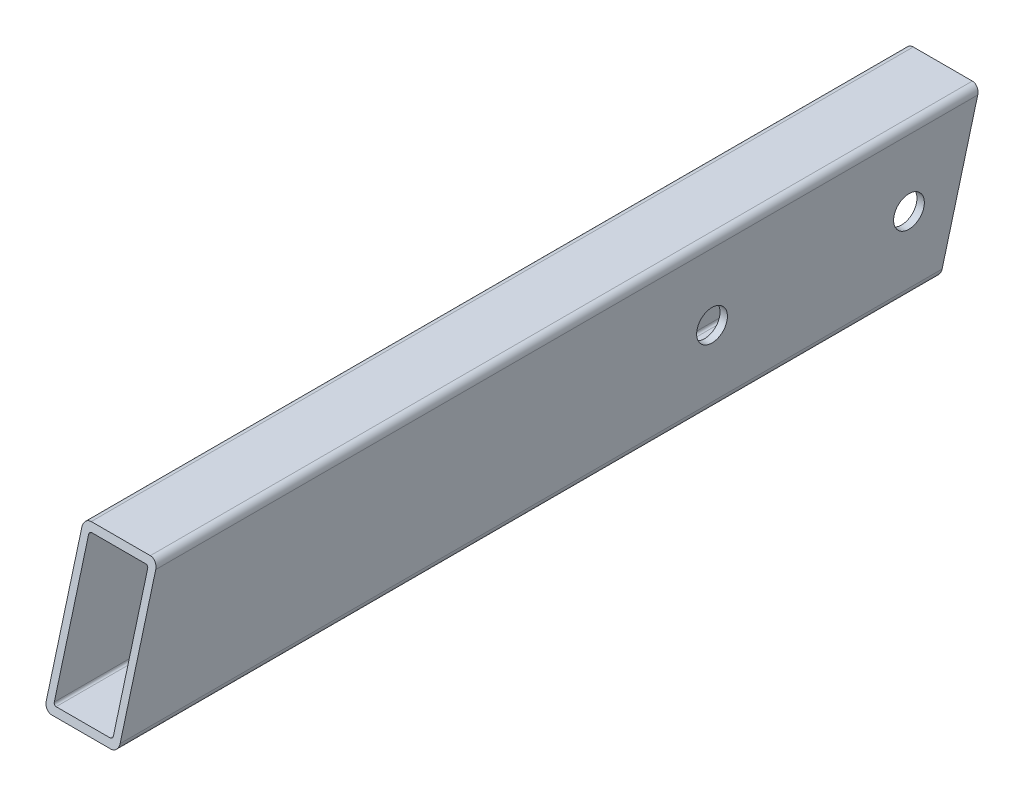
from build123d import *

# Parameters (mm, degrees)
DODANIE_WYCI_GNI_CIE1_DEPTH     = 350
WYTNIJ_WYCI_GNI_CIE1_DEPTH      = 52
WYTNIJ_WYCI_GNI_CIE1_DEPTH_BACK = 50
WYTNIJ_WYCI_GNI_CIE2_DEPTH      = 31
WYTNIJ_WYCI_GNI_CIE2_DEPTH_BACK = 26
SZKIC3_R                        = 6.25


with BuildPart() as part:
    # Szkic1 → Dodanie-wyciągnięcie1 (new body)
    with BuildSketch(Plane.XY):
        with BuildLine():
            Line((-8.196850851, -30), (15.803149149, -30))
            ThreePointArc((15.803149149, -30), (17.924469493, -29.121320344), (18.803149149, -27))
            Line((18.803149149, -27), (18.803149149, 27))
            ThreePointArc((18.803149149, 27), (17.924469493, 29.121320344), (15.803149149, 30))
            Line((15.803149149, 30), (-8.196850851, 30))
            ThreePointArc((-8.196850851, 30), (-10.318171195, 29.121320344), (-11.196850851, 27))
            Line((-11.196850851, 27), (-11.196850851, -27))
            ThreePointArc((-11.196850851, -27), (-10.318171195, -29.121320344), (-8.196850851, -30))
        make_face()
        with BuildLine():
            Line((-7.196850851, 27), (14.803149149, 27))
            ThreePointArc((14.803149149, 27), (15.51025593, 26.707106781), (15.803149149, 26))
            Line((15.803149149, 26), (15.803149149, -26))
            ThreePointArc((15.803149149, -26), (15.51025593, -26.707106781), (14.803149149, -27))
            Line((14.803149149, -27), (-7.196850851, -27))
            ThreePointArc((-7.196850851, -27), (-7.903957632, -26.707106781), (-8.196850851, -26))
            Line((-8.196850851, -26), (-8.196850851, 26))
            ThreePointArc((-8.196850851, 26), (-7.903957632, 26.707106781), (-7.196850851, 27))
        make_face(mode=Mode.SUBTRACT)
    extrude(amount=-DODANIE_WYCI_GNI_CIE1_DEPTH)

    # Szkic2 → Wytnij-wyciągnięcie1 (cut, two sides: drawn at the far end of the back side and taken through both)
    with BuildSketch(Plane(origin=(0, 0, 0), x_dir=(0, 0, -1), z_dir=(1, 0, 0)).offset(-WYTNIJ_WYCI_GNI_CIE1_DEPTH_BACK)):
        Polygon((0, -30), (16.076951546, 30), (0, 30), align=None)
        Polygon((350, 30), (333.923048454, -30), (350, -30), align=None)
    extrude(amount=WYTNIJ_WYCI_GNI_CIE1_DEPTH + WYTNIJ_WYCI_GNI_CIE1_DEPTH_BACK, mode=Mode.SUBTRACT)

    # Szkic3 → Wytnij-wyciągnięcie2 (cut, two sides: drawn at the far end of the back side and taken through both)
    with BuildSketch(Plane(origin=(0, 0, 0), x_dir=(0, 0, -1), z_dir=(1, 0, 0)).offset(-WYTNIJ_WYCI_GNI_CIE2_DEPTH_BACK)):
        with Locations((241.256000619, 0)):
            Circle(SZKIC3_R)
        with Locations((321.256000619, 0)):
            Circle(SZKIC3_R)
    extrude(amount=WYTNIJ_WYCI_GNI_CIE2_DEPTH + WYTNIJ_WYCI_GNI_CIE2_DEPTH_BACK, mode=Mode.SUBTRACT)


solid = part.part
